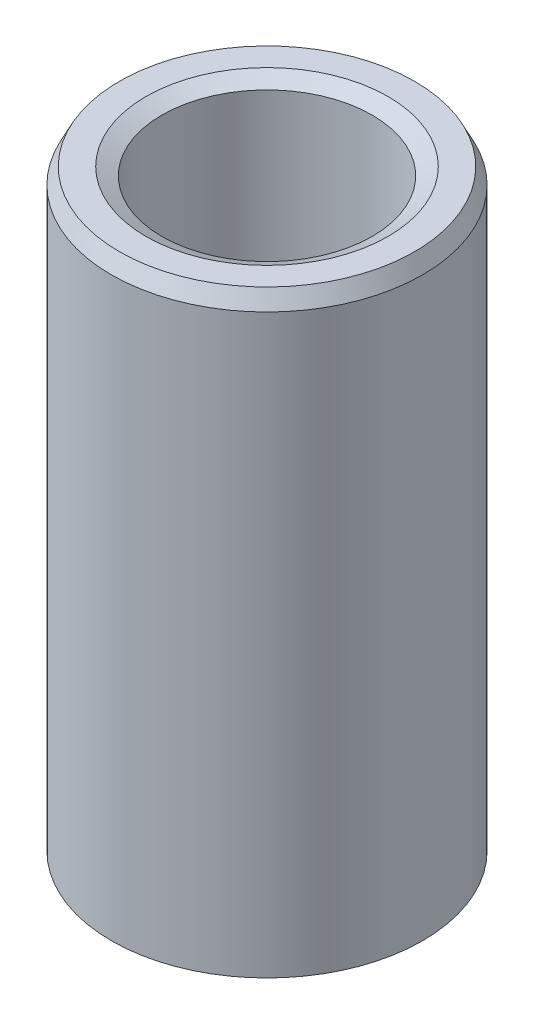
from build123d import *
from OCP.BRepFilletAPI import BRepFilletAPI_MakeChamfer

# Parameters (mm, degrees)
SKETCH1_R           = 15
BOSS_EXTRUDE1_DEPTH = 57.900055644
SKETCH2_R           = 10.134953111
CUT_EXTRUDE1_DEPTH  = 62.66373686
CHAMFER1_SIZE       = 1.541362356
CHAMFER1_SIZE2      = 0.773980148


with BuildPart() as part:
    # Sketch1 → Boss-Extrude1 (new body)
    with BuildSketch(Plane(origin=(0, 0, 0), x_dir=(1, 0, 0), z_dir=(0, 1, 0))):
        Circle(SKETCH1_R)
    extrude(amount=BOSS_EXTRUDE1_DEPTH)

    # Sketch2 → Cut-Extrude1 (cut, through all)
    with BuildSketch(Plane(origin=(0, 0, 0), x_dir=(1, 0, 0), z_dir=(0, 1, 0))):
        Circle(SKETCH2_R)
    extrude(amount=CUT_EXTRUDE1_DEPTH, mode=Mode.SUBTRACT)

    # Chamfer1: one chamfer whose edges measure the first distance from different faces: ONE call of the kernel's chamfer builder (chamfer() names one face for all edges)
    chamfer1_edges_1 = [part.edges().sort_by_distance(p)[0] for p in [
        (-10.134953111, 57.900055644, 0),
    ]]
    chamfer1_side_1 = [part.faces().sort_by_distance(p)[0] for p in [
        (-14.575735931, 57.900055644, 0),
    ]]
    chamfer1_edges_2 = [part.edges().sort_by_distance(p)[0] for p in [
        (-10.134953111, 0, 0),
    ]]
    chamfer1_side_2 = [part.faces().sort_by_distance(p)[0] for p in [
        (-10.134953111, 28.950027822, 0),
    ]]
    chamfer1_edges_3 = [part.edges().sort_by_distance(p)[0] for p in [
        (-15, 0, 0),
    ]]
    chamfer1_side_3 = [part.faces().sort_by_distance(p)[0] for p in [
        (-14.575735931, 0, 0),
    ]]
    chamfer1_edges_4 = [part.edges().sort_by_distance(p)[0] for p in [
        (-15, 57.900055644, 0),
    ]]
    chamfer1_side_4 = [part.faces().sort_by_distance(p)[0] for p in [
        (-15, 28.950027822, 0),
    ]]
    chamfer1 = BRepFilletAPI_MakeChamfer(part.part.solid().wrapped)
    for e in chamfer1_edges_1:
        chamfer1.Add(CHAMFER1_SIZE, CHAMFER1_SIZE2, e.wrapped, chamfer1_side_1[0].wrapped)  # the first distance lies on this face
    for e in chamfer1_edges_2:
        chamfer1.Add(CHAMFER1_SIZE, CHAMFER1_SIZE2, e.wrapped, chamfer1_side_2[0].wrapped)  # the first distance lies on this face
    for e in chamfer1_edges_3:
        chamfer1.Add(CHAMFER1_SIZE, CHAMFER1_SIZE2, e.wrapped, chamfer1_side_3[0].wrapped)  # the first distance lies on this face
    for e in chamfer1_edges_4:
        chamfer1.Add(CHAMFER1_SIZE, CHAMFER1_SIZE2, e.wrapped, chamfer1_side_4[0].wrapped)  # the first distance lies on this face
    add(Compound.cast(chamfer1.Shape()), mode=Mode.REPLACE)


solid = part.part
